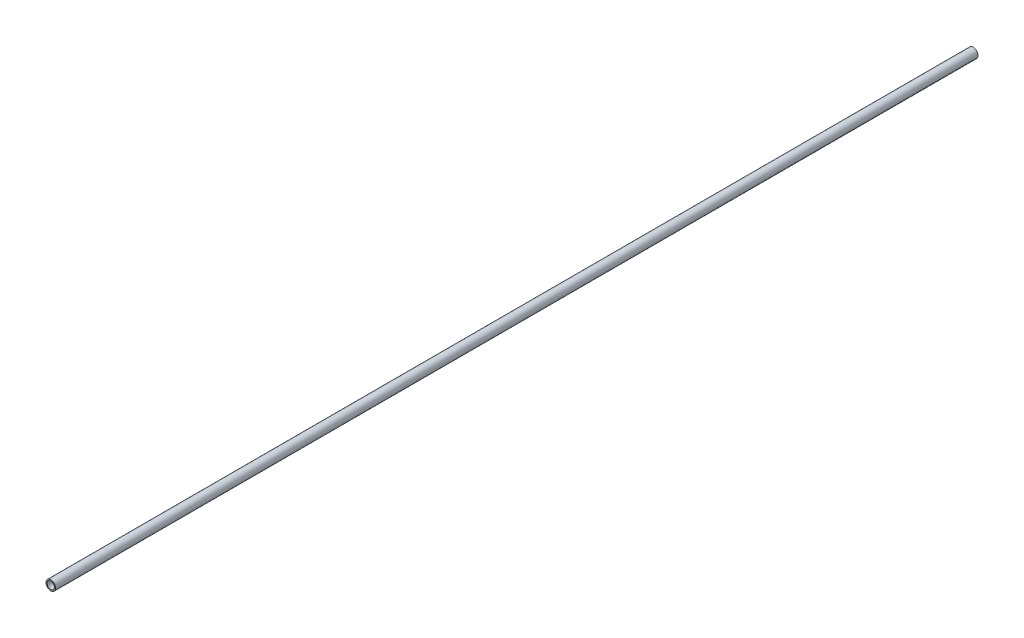
from build123d import *

# Parameters (mm, degrees)
SKETCH1_R           = 6.35
SKETCH1_R_2         = 4.826
BOSS_EXTRUDE1_DEPTH = 1219.2


with BuildPart() as part:
    # Sketch1 → Boss-Extrude1 (new body)
    with BuildSketch(Plane.XY):
        Circle(SKETCH1_R)
        Circle(SKETCH1_R_2, mode=Mode.SUBTRACT)
    extrude(amount=BOSS_EXTRUDE1_DEPTH)


solid = part.part
